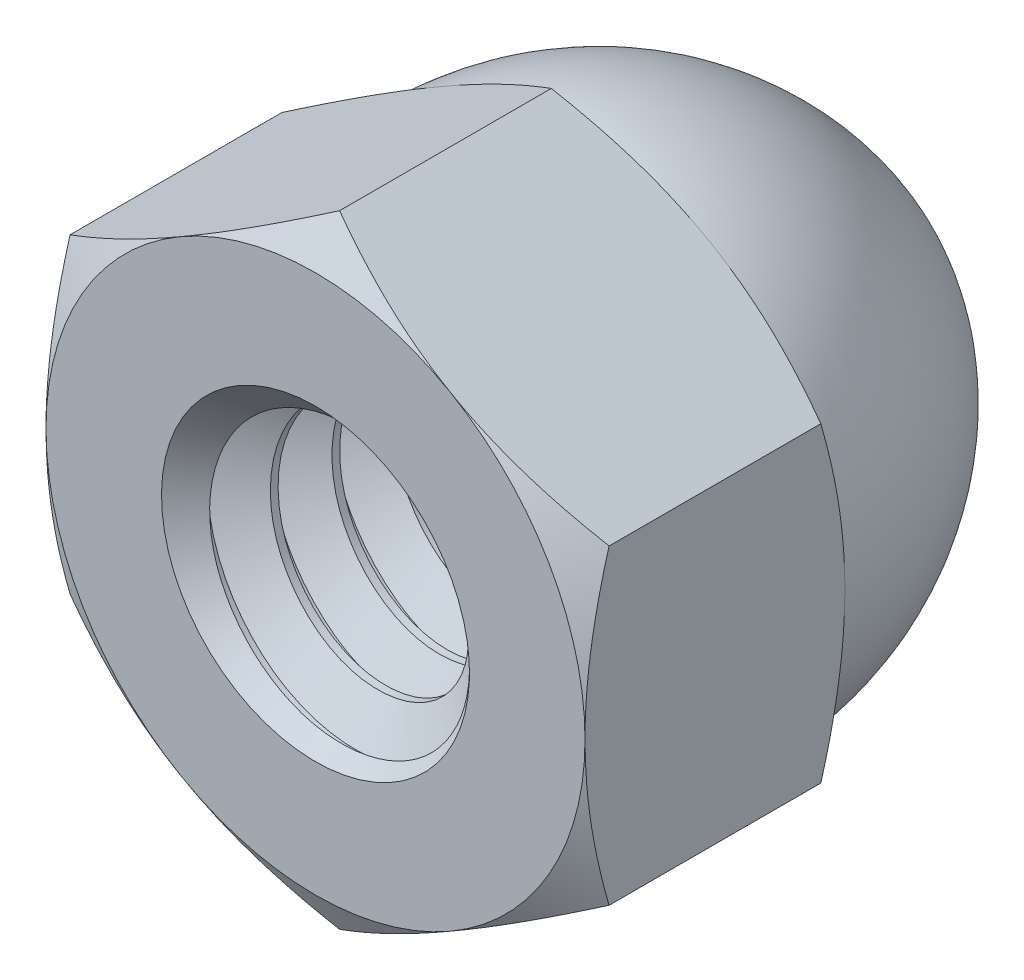
from build123d import *

# Parameters (mm, degrees)
EXTRUDE1_DEPTH     = 5.3578125
SKETCH2_OUTSIDE_W  = 54.906
SKETCH2_OUTSIDE_H  = 56.626
SKETCH2_OUTSIDE_R  = 5.55625
CUT_EXTRUDE1_DEPTH = 11.036962734
CUT_EXTRUDE1_DRAFT = -60
SKETCH3_OUTSIDE_W  = 54.906
SKETCH3_OUTSIDE_H  = 56.626
SKETCH3_OUTSIDE_R  = 5.55625
CUT_EXTRUDE2_DEPTH = 11.036962734
CUT_EXTRUDE2_DRAFT = -60
SKETCH4_R          = 3.175
CUT_EXTRUDE3_DEPTH = 6.35
SWEEP1_PITCH       = 1.27
CUT_EXTRUDE8_DEPTH = 15.621670777


with BuildPart() as part:
    # Sketch1 → Extrude1 (new body)
    with BuildSketch(Plane.XY):
        Polygon((0, 6.415804866), (-5.55625, 3.207902433), (-5.55625, -3.207902433), (0, -6.415804866), (5.55625, -3.207902433), (5.55625, 3.207902433), align=None)
    extrude(amount=-EXTRUDE1_DEPTH)


with BuildPart() as cut_extrude1_tool:
    # Sketch2 outside → Cut-Extrude1 (with draft: the straight prism first)
    with BuildSketch(Plane.XY):
        Rectangle(SKETCH2_OUTSIDE_W, SKETCH2_OUTSIDE_H)
        Circle(SKETCH2_OUTSIDE_R, mode=Mode.SUBTRACT)
    extrude(amount=-CUT_EXTRUDE1_DEPTH)
    # Cut-Extrude1: the draft: its side faces are tilted about the plane it starts from
    cut_extrude1_sides = [cut_extrude1_tool.faces().sort_by_distance(p)[0] for p in [
        (0, -28.313, -5.518481367),
        (27.453, 0, -5.518481367),
        (0, 28.313, -5.518481367),
        (-27.453, 0, -5.518481367),
        (-5.55625, 0, -5.518481367),
    ]]
    draft(cut_extrude1_sides, Plane.XY, CUT_EXTRUDE1_DRAFT)


with BuildPart() as part_1:
    add(part.part)

    # Cut-Extrude1: cut by cut_extrude1_tool
    add(cut_extrude1_tool.part, mode=Mode.SUBTRACT)


with BuildPart() as cut_extrude2_tool:
    # Sketch3 outside → Cut-Extrude2 (with draft: the straight prism first)
    with BuildSketch(Plane(origin=(0, 0, -5.3578125), x_dir=(-1, 0, 0), z_dir=(0, 0, -1))):
        Rectangle(SKETCH3_OUTSIDE_W, SKETCH3_OUTSIDE_H)
        Circle(SKETCH3_OUTSIDE_R, mode=Mode.SUBTRACT)
    extrude(amount=-CUT_EXTRUDE2_DEPTH)
    # Cut-Extrude2: the draft: its side faces are tilted about the plane it starts from
    cut_extrude2_sides = [cut_extrude2_tool.faces().sort_by_distance(p)[0] for p in [
        (0, -28.313, 0.160668867),
        (-27.453, 0, 0.160668867),
        (0, 28.313, 0.160668867),
        (27.453, 0, 0.160668867),
        (5.55625, 0, 0.160668867),
    ]]
    draft(cut_extrude2_sides, Plane(origin=(0, 0, -5.3578125), x_dir=(-1, 0, 0), z_dir=(0, 0, -1)), CUT_EXTRUDE2_DRAFT)


with BuildPart() as part_2:
    add(part_1.part)

    # Cut-Extrude2: cut by cut_extrude2_tool
    add(cut_extrude2_tool.part, mode=Mode.SUBTRACT)

    # Sketch14 → Revolve1 (revolve)
    with BuildSketch(Plane(origin=(0, 0, 0), x_dir=(0, 0, -1), z_dir=(1, 0, 0))):
        with BuildLine():
            Line((5.3578125, 5.55625), (5.3578125, 0))
            Line((5.3578125, 0), (11.90625, 0))
            ThreePointArc((11.90625, 0), (9.651818431, 3.980017035), (5.3578125, 5.55625))
        make_face()
    revolve(axis=Axis((0, 0, 0), (0, 0, -1)))

    # Sketch4 → Cut-Extrude3 (cut)
    with BuildSketch(Plane.XY):
        Circle(SKETCH4_R)
    extrude(amount=-CUT_EXTRUDE3_DEPTH, mode=Mode.SUBTRACT)

    # Sweep1: the profile of Sketch16 profile screwed along a right-hand helix of 7.5 turns, 6 arcs to a turn; built about Z, then put on its axis
    sweep1_z = Axis((0, 0, 0), (0, 0, 1))
    sweep1_corners = [(3.1753, 0, 0.000173205), (3.1753, 0, -1.111423205), (2.350110803, 0, -0.635), (2.350110803, 0, -0.47625)]
    with BuildLine(mode=Mode.PRIVATE) as sweep1_profile:
        Line(sweep1_corners[0], sweep1_corners[1])
        Line(sweep1_corners[1], sweep1_corners[2])
        Line(sweep1_corners[2], sweep1_corners[3])
        Line(sweep1_corners[3], sweep1_corners[0])
    sweep1_cap = Face(sweep1_profile.wire())
    sweep1_turn_angles = [0, 30, 60, 90, 120, 150, 180, 210, 240, 270, 300, 330, 360]
    sweep1_turn_weights = [1, 0.8660254037844387, 1, 0.8660254037844387, 1, 0.8660254037844387, 1, 0.8660254037844387, 1, 0.8660254037844387, 1, 0.8660254037844387, 1]
    sweep1_turn_rails = [Edge.make_bspline([Vector(p[0], p[1], 0).rotate(sweep1_z, sweep1_turn_angles[k]) / sweep1_turn_weights[k] + Vector(0, 0, p[2] + SWEEP1_PITCH * sweep1_turn_angles[k] / 360) for k in range(13)], [0, 0, 0, 1, 1, 2, 2, 3, 3, 4, 4, 5, 5, 6, 6, 6], 2, sweep1_turn_weights) for p in sweep1_corners]
    sweep1_turn_sides = [Face.make_surface_from_curves(sweep1_turn_rails[p[0]], sweep1_turn_rails[p[1]]) for p in [(0, 1), (1, 2), (2, 3), (3, 0)]]
    sweep1_last_angles = [2520, 2550, 2580, 2610, 2640, 2670, 2700]
    sweep1_last_weights = [1, 0.8660254037844387, 1, 0.8660254037844387, 1, 0.8660254037844526, 1]
    sweep1_last_rails = [Edge.make_bspline([Vector(p[0], p[1], 0).rotate(sweep1_z, sweep1_last_angles[k]) / sweep1_last_weights[k] + Vector(0, 0, p[2] + SWEEP1_PITCH * sweep1_last_angles[k] / 360) for k in range(7)], [0, 0, 0, 1, 1, 2, 2, 3, 3, 3], 2, sweep1_last_weights) for p in sweep1_corners]
    sweep1_last_sides = [Face.make_surface_from_curves(sweep1_last_rails[p[0]], sweep1_last_rails[p[1]]) for p in [(0, 1), (1, 2), (2, 3), (3, 0)]]
    sweep1 = Plane(origin=(0, 0, -6.35), x_dir=(0, 1, 0), z_dir=(0, 0, 1)) * Solid(Shell([*[p.moved(Location((0, 0, SWEEP1_PITCH * i))) for i in range(7) for p in sweep1_turn_sides], *sweep1_last_sides, sweep1_cap, sweep1_cap.rotate(sweep1_z, 2700).moved(Location((0, 0, SWEEP1_PITCH * 2700 / 360)))]))
    add(sweep1)

    # Sketch17 → Cut-Extrude8 (cut, through all)
    with BuildSketch(Plane.XY):
        Polygon((0, 6.415804866), (-5.55625, 3.207902433), (-5.55625, -3.207902433), (0, -6.415804866), (5.55625, -3.207902433), (5.55625, 3.207902433), align=None)
    extrude(amount=CUT_EXTRUDE8_DEPTH, mode=Mode.SUBTRACT)

    # Cut-Extrude9 cone 1 section (through the dimple's axis) → Cut-Extrude9 (revolve, cut)
    with BuildSketch(Plane(origin=(0, 0, 0), x_dir=(0, -1, 0), z_dir=(1, 0, 0))):
        Polygon((0, 0), (3.175, 0), (0, 3.175), align=None)
    revolve(axis=Axis((0, 0, 0), (0, 0, -1)), mode=Mode.SUBTRACT)

    # Sketch20 → Cut-Revolve1 (revolve, cut)
    with BuildSketch(Plane(origin=(0, 0, 0), x_dir=(0, 0, -1), z_dir=(1, 0, 0)), mode=Mode.PRIVATE) as cut_revolve1_sk:
        Polygon((6.985, 3.175), (8.818087105, 0), (6.35, 0), (6.35, 3.175), align=None)
    revolve(cut_revolve1_sk.sketch.rotate(Axis((0, 0, 0), (0, 0, 1)), 315.522487814), axis=Axis((0, 0, 0), (0, 0, 1)), mode=Mode.SUBTRACT)


solid = part_2.part
